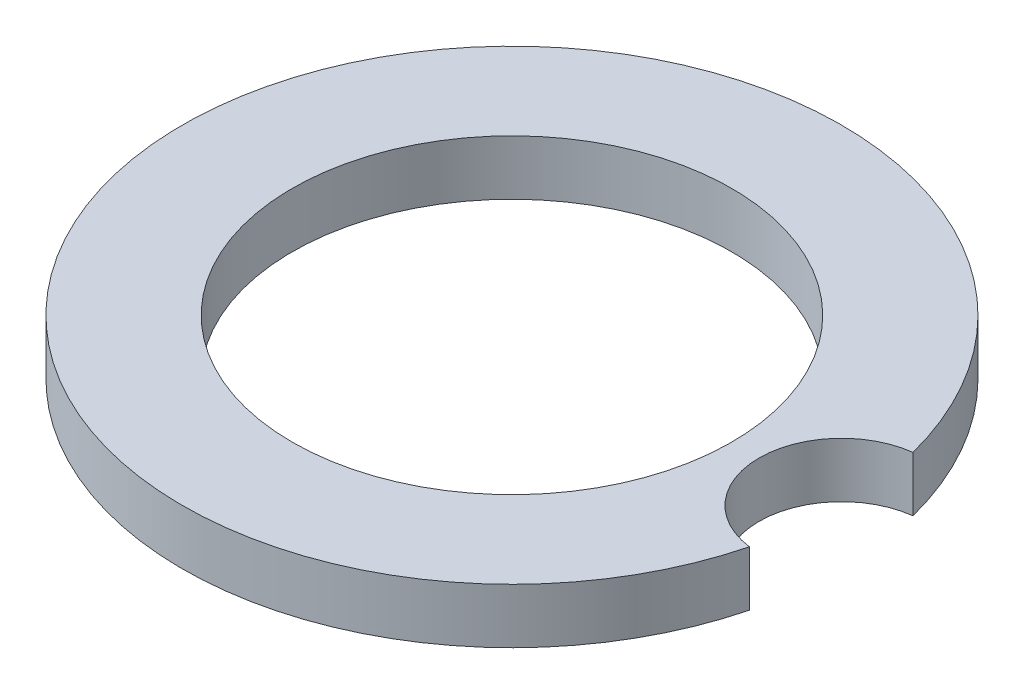
from build123d import *

# Parameters (mm, degrees)
SKETCH1_R           = 76.1746
BOSS_EXTRUDE1_DEPTH = 12.7
SKETCH1_10_R        = 50.8
CUT_EXTRUDE2_DEPTH  = 109.473173505
CUT_EXTRUDE3_DEPTH  = 109.473173505


with BuildPart() as part:
    # Sketch1 → Boss-Extrude1 (new body)
    with BuildSketch(Plane(origin=(0, 0, 0), x_dir=(1, 0, 0), z_dir=(0, 1, 0))):
        Circle(SKETCH1_R)
    extrude(amount=BOSS_EXTRUDE1_DEPTH)

    # Sketch1<10> → Cut-Extrude2 (cut, through all)
    with BuildSketch(Plane(origin=(0, 0, 0), x_dir=(1, 0, 0), z_dir=(0, 1, 0))):
        Circle(SKETCH1_10_R)
    extrude(amount=CUT_EXTRUDE2_DEPTH, mode=Mode.SUBTRACT)

    # Sketch2 → Cut-Extrude3 (cut, through all)
    with BuildSketch(Plane(origin=(0, 12.7, 0), x_dir=(1, 0, 0), z_dir=(0, 1, 0))):
        with BuildLine():
            Line((76.2, 19.05), (76.2, -19.05))
            ThreePointArc((76.2, -19.05), (57.124583067, 0), (76.2, 19.05))
        make_face()
    extrude(amount=-CUT_EXTRUDE3_DEPTH, mode=Mode.SUBTRACT)


solid = part.part
